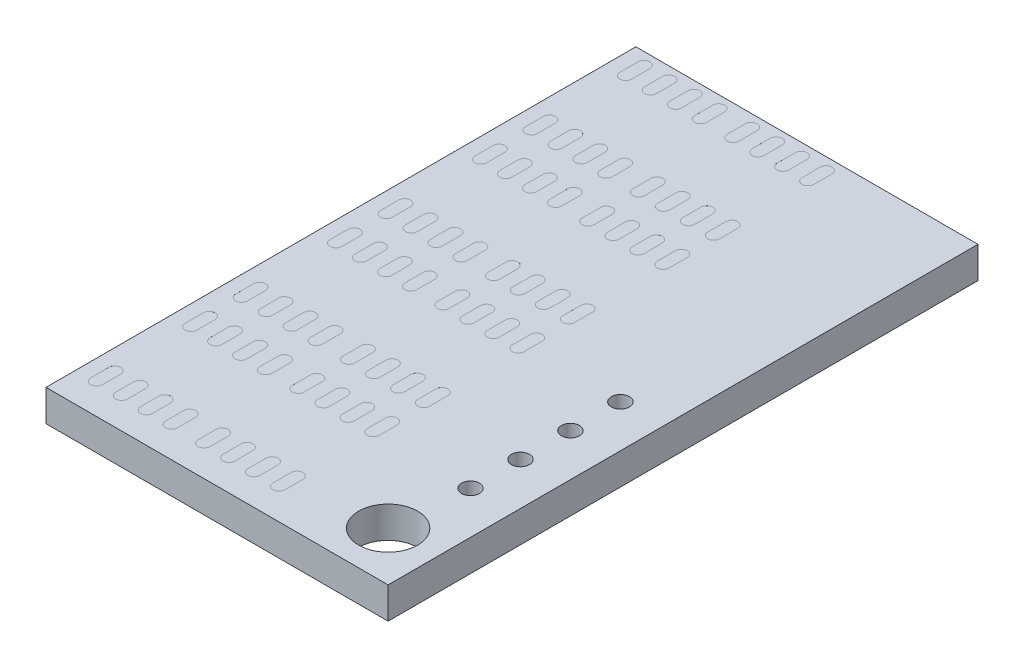
from build123d import *

# Parameters (mm, degrees)
SKETCH_1_W          = 17.4
SKETCH_1_H          = 30
EXTRUDE_1_DEPTH     = 1.6
SKETCH_2_R          = 1.5
SKETCH_2_R_2        = 0.457
CUT_EXTRUDE_1_DEPTH = 1.6
CUT_EXTRUDE_2_DEPTH = 0.0001


with BuildPart() as part:
    # Эскиз1 → Бобышка-Вытянуть1 (new body)
    with BuildSketch(Plane(origin=(0, 0, 0), x_dir=(1, 0, 0), z_dir=(0, 1, 0))):
        Rectangle(SKETCH_1_W, SKETCH_1_H)
    extrude(amount=EXTRUDE_1_DEPTH)

    # Эскиз2 → Вырез-Вытянуть1 (cut)
    with BuildSketch(Plane(origin=(0, 1.6, 0), x_dir=(1, 0, 0), z_dir=(0, 1, 0))):
        with Locations((6.2, -12.5)):
            Circle(SKETCH_2_R)
        with Locations((6.541, -1.03)):
            Circle(SKETCH_2_R_2)
        with Locations((6.541, -3.57)):
            Circle(SKETCH_2_R_2)
        with Locations((6.541, -6.11)):
            Circle(SKETCH_2_R_2)
        with Locations((6.541, -8.65)):
            Circle(SKETCH_2_R_2)
    extrude(amount=-CUT_EXTRUDE_1_DEPTH, mode=Mode.SUBTRACT)

    # Эскиз3 → Вырез-Вытянуть2 (cut)
    with BuildSketch(Plane(origin=(0, 1.6, 0), x_dir=(1, 0, 0), z_dir=(0, 1, 0))):
        with BuildLine():
            Line((-7.384, 14.39), (-7.384, 13.47))
            ThreePointArc((-7.384, 13.47), (-7.684, 13.17), (-7.984, 13.47))
            Line((-7.984, 13.47), (-7.984, 14.39))
            ThreePointArc((-7.984, 14.39), (-7.684, 14.69), (-7.384, 14.39))
        make_face()
        with BuildLine():
            Line((-6.114, 14.39), (-6.114, 13.47))
            ThreePointArc((-6.114, 13.47), (-6.414, 13.17), (-6.714, 13.47))
            Line((-6.714, 13.47), (-6.714, 14.39))
            ThreePointArc((-6.714, 14.39), (-6.414, 14.69), (-6.114, 14.39))
        make_face()
        with BuildLine():
            Line((-4.844, 14.39), (-4.844, 13.47))
            ThreePointArc((-4.844, 13.47), (-5.144, 13.17), (-5.444, 13.47))
            Line((-5.444, 13.47), (-5.444, 14.39))
            ThreePointArc((-5.444, 14.39), (-5.144, 14.69), (-4.844, 14.39))
        make_face()
        with BuildLine():
            Line((-3.574, 14.39), (-3.574, 13.47))
            ThreePointArc((-3.574, 13.47), (-3.874, 13.17), (-4.174, 13.47))
            Line((-4.174, 13.47), (-4.174, 14.39))
            ThreePointArc((-4.174, 14.39), (-3.874, 14.69), (-3.574, 14.39))
        make_face()
        with BuildLine():
            Line((-6.114, 9.59), (-6.114, 8.67))
            ThreePointArc((-6.114, 8.67), (-6.414, 8.37), (-6.714, 8.67))
            Line((-6.714, 8.67), (-6.714, 9.59))
            ThreePointArc((-6.714, 9.59), (-6.414, 9.89), (-6.114, 9.59))
        make_face()
        with BuildLine():
            Line((-4.844, 9.59), (-4.844, 8.67))
            ThreePointArc((-4.844, 8.67), (-5.144, 8.37), (-5.444, 8.67))
            Line((-5.444, 8.67), (-5.444, 9.59))
            ThreePointArc((-5.444, 9.59), (-5.144, 9.89), (-4.844, 9.59))
        make_face()
        with BuildLine():
            Line((-3.574, 9.59), (-3.574, 8.67))
            ThreePointArc((-3.574, 8.67), (-3.874, 8.37), (-4.174, 8.67))
            Line((-4.174, 8.67), (-4.174, 9.59))
            ThreePointArc((-4.174, 9.59), (-3.874, 9.89), (-3.574, 9.59))
        make_face()
        with BuildLine():
            Line((-7.384, 9.59), (-7.384, 8.67))
            ThreePointArc((-7.384, 8.67), (-7.684, 8.37), (-7.984, 8.67))
            Line((-7.984, 8.67), (-7.984, 9.59))
            ThreePointArc((-7.984, 9.59), (-7.684, 9.89), (-7.384, 9.59))
        make_face()
        with BuildLine():
            Line((-1.924, 14.39), (-1.924, 13.47))
            ThreePointArc((-1.924, 13.47), (-2.224, 13.17), (-2.524, 13.47))
            Line((-2.524, 13.47), (-2.524, 14.39))
            ThreePointArc((-2.524, 14.39), (-2.224, 14.69), (-1.924, 14.39))
        make_face()
        with BuildLine():
            Line((-0.654, 14.39), (-0.654, 13.47))
            ThreePointArc((-0.654, 13.47), (-0.954, 13.17), (-1.254, 13.47))
            Line((-1.254, 13.47), (-1.254, 14.39))
            ThreePointArc((-1.254, 14.39), (-0.954, 14.69), (-0.654, 14.39))
        make_face()
        with BuildLine():
            Line((0.616, 14.39), (0.616, 13.47))
            ThreePointArc((0.616, 13.47), (0.316, 13.17), (0.016, 13.47))
            Line((0.016, 13.47), (0.016, 14.39))
            ThreePointArc((0.016, 14.39), (0.316, 14.69), (0.616, 14.39))
        make_face()
        with BuildLine():
            Line((1.886, 14.39), (1.886, 13.47))
            ThreePointArc((1.886, 13.47), (1.586, 13.17), (1.286, 13.47))
            Line((1.286, 13.47), (1.286, 14.39))
            ThreePointArc((1.286, 14.39), (1.586, 14.69), (1.886, 14.39))
        make_face()
        with BuildLine():
            Line((-0.654, 9.59), (-0.654, 8.67))
            ThreePointArc((-0.654, 8.67), (-0.954, 8.37), (-1.254, 8.67))
            Line((-1.254, 8.67), (-1.254, 9.59))
            ThreePointArc((-1.254, 9.59), (-0.954, 9.89), (-0.654, 9.59))
        make_face()
        with BuildLine():
            Line((0.616, 9.59), (0.616, 8.67))
            ThreePointArc((0.616, 8.67), (0.316, 8.37), (0.016, 8.67))
            Line((0.016, 8.67), (0.016, 9.59))
            ThreePointArc((0.016, 9.59), (0.316, 9.89), (0.616, 9.59))
        make_face()
        with BuildLine():
            Line((1.886, 9.59), (1.886, 8.67))
            ThreePointArc((1.886, 8.67), (1.586, 8.37), (1.286, 8.67))
            Line((1.286, 8.67), (1.286, 9.59))
            ThreePointArc((1.286, 9.59), (1.586, 9.89), (1.886, 9.59))
        make_face()
        with BuildLine():
            Line((-1.924, 9.59), (-1.924, 8.67))
            ThreePointArc((-1.924, 8.67), (-2.224, 8.37), (-2.524, 8.67))
            Line((-2.524, 8.67), (-2.524, 9.59))
            ThreePointArc((-2.524, 9.59), (-2.224, 9.89), (-1.924, 9.59))
        make_face()
        with BuildLine():
            Line((-1.924, 7.02), (-1.924, 6.1))
            ThreePointArc((-1.924, 6.1), (-2.224, 5.8), (-2.524, 6.1))
            Line((-2.524, 6.1), (-2.524, 7.02))
            ThreePointArc((-2.524, 7.02), (-2.224, 7.32), (-1.924, 7.02))
        make_face()
        with BuildLine():
            Line((-0.654, 7.02), (-0.654, 6.1))
            ThreePointArc((-0.654, 6.1), (-0.954, 5.8), (-1.254, 6.1))
            Line((-1.254, 6.1), (-1.254, 7.02))
            ThreePointArc((-1.254, 7.02), (-0.954, 7.32), (-0.654, 7.02))
        make_face()
        with BuildLine():
            Line((0.616, 7.02), (0.616, 6.1))
            ThreePointArc((0.616, 6.1), (0.316, 5.8), (0.016, 6.1))
            Line((0.016, 6.1), (0.016, 7.02))
            ThreePointArc((0.016, 7.02), (0.316, 7.32), (0.616, 7.02))
        make_face()
        with BuildLine():
            Line((1.886, 7.02), (1.886, 6.1))
            ThreePointArc((1.886, 6.1), (1.586, 5.8), (1.286, 6.1))
            Line((1.286, 6.1), (1.286, 7.02))
            ThreePointArc((1.286, 7.02), (1.586, 7.32), (1.886, 7.02))
        make_face()
        with BuildLine():
            Line((-0.654, 2.22), (-0.654, 1.3))
            ThreePointArc((-0.654, 1.3), (-0.954, 1), (-1.254, 1.3))
            Line((-1.254, 1.3), (-1.254, 2.22))
            ThreePointArc((-1.254, 2.22), (-0.954, 2.52), (-0.654, 2.22))
        make_face()
        with BuildLine():
            Line((0.616, 2.22), (0.616, 1.3))
            ThreePointArc((0.616, 1.3), (0.316, 1), (0.016, 1.3))
            Line((0.016, 1.3), (0.016, 2.22))
            ThreePointArc((0.016, 2.22), (0.316, 2.52), (0.616, 2.22))
        make_face()
        with BuildLine():
            Line((1.886, 2.22), (1.886, 1.3))
            ThreePointArc((1.886, 1.3), (1.586, 1), (1.286, 1.3))
            Line((1.286, 1.3), (1.286, 2.22))
            ThreePointArc((1.286, 2.22), (1.586, 2.52), (1.886, 2.22))
        make_face()
        with BuildLine():
            Line((-1.924, 2.22), (-1.924, 1.3))
            ThreePointArc((-1.924, 1.3), (-2.224, 1), (-2.524, 1.3))
            Line((-2.524, 1.3), (-2.524, 2.22))
            ThreePointArc((-2.524, 2.22), (-2.224, 2.52), (-1.924, 2.22))
        make_face()
        with BuildLine():
            Line((-1.924, -0.35), (-1.924, -1.27))
            ThreePointArc((-1.924, -1.27), (-2.224, -1.57), (-2.524, -1.27))
            Line((-2.524, -1.27), (-2.524, -0.35))
            ThreePointArc((-2.524, -0.35), (-2.224, -0.05), (-1.924, -0.35))
        make_face()
        with BuildLine():
            Line((-0.654, -0.35), (-0.654, -1.27))
            ThreePointArc((-0.654, -1.27), (-0.954, -1.57), (-1.254, -1.27))
            Line((-1.254, -1.27), (-1.254, -0.35))
            ThreePointArc((-1.254, -0.35), (-0.954, -0.05), (-0.654, -0.35))
        make_face()
        with BuildLine():
            Line((0.616, -0.35), (0.616, -1.27))
            ThreePointArc((0.616, -1.27), (0.316, -1.57), (0.016, -1.27))
            Line((0.016, -1.27), (0.016, -0.35))
            ThreePointArc((0.016, -0.35), (0.316, -0.05), (0.616, -0.35))
        make_face()
        with BuildLine():
            Line((1.886, -0.35), (1.886, -1.27))
            ThreePointArc((1.886, -1.27), (1.586, -1.57), (1.286, -1.27))
            Line((1.286, -1.27), (1.286, -0.35))
            ThreePointArc((1.286, -0.35), (1.586, -0.05), (1.886, -0.35))
        make_face()
        with BuildLine():
            Line((-0.654, -5.15), (-0.654, -6.07))
            ThreePointArc((-0.654, -6.07), (-0.954, -6.37), (-1.254, -6.07))
            Line((-1.254, -6.07), (-1.254, -5.15))
            ThreePointArc((-1.254, -5.15), (-0.954, -4.85), (-0.654, -5.15))
        make_face()
        with BuildLine():
            Line((0.616, -5.15), (0.616, -6.07))
            ThreePointArc((0.616, -6.07), (0.316, -6.37), (0.016, -6.07))
            Line((0.016, -6.07), (0.016, -5.15))
            ThreePointArc((0.016, -5.15), (0.316, -4.85), (0.616, -5.15))
        make_face()
        with BuildLine():
            Line((1.886, -5.15), (1.886, -6.07))
            ThreePointArc((1.886, -6.07), (1.586, -6.37), (1.286, -6.07))
            Line((1.286, -6.07), (1.286, -5.15))
            ThreePointArc((1.286, -5.15), (1.586, -4.85), (1.886, -5.15))
        make_face()
        with BuildLine():
            Line((-1.924, -5.15), (-1.924, -6.07))
            ThreePointArc((-1.924, -6.07), (-2.224, -6.37), (-2.524, -6.07))
            Line((-2.524, -6.07), (-2.524, -5.15))
            ThreePointArc((-2.524, -5.15), (-2.224, -4.85), (-1.924, -5.15))
        make_face()
        with BuildLine():
            Line((-1.924, -7.72), (-1.924, -8.64))
            ThreePointArc((-1.924, -8.64), (-2.224, -8.94), (-2.524, -8.64))
            Line((-2.524, -8.64), (-2.524, -7.72))
            ThreePointArc((-2.524, -7.72), (-2.224, -7.42), (-1.924, -7.72))
        make_face()
        with BuildLine():
            Line((-0.654, -7.72), (-0.654, -8.64))
            ThreePointArc((-0.654, -8.64), (-0.954, -8.94), (-1.254, -8.64))
            Line((-1.254, -8.64), (-1.254, -7.72))
            ThreePointArc((-1.254, -7.72), (-0.954, -7.42), (-0.654, -7.72))
        make_face()
        with BuildLine():
            Line((0.616, -7.72), (0.616, -8.64))
            ThreePointArc((0.616, -8.64), (0.316, -8.94), (0.016, -8.64))
            Line((0.016, -8.64), (0.016, -7.72))
            ThreePointArc((0.016, -7.72), (0.316, -7.42), (0.616, -7.72))
        make_face()
        with BuildLine():
            Line((1.886, -7.72), (1.886, -8.64))
            ThreePointArc((1.886, -8.64), (1.586, -8.94), (1.286, -8.64))
            Line((1.286, -8.64), (1.286, -7.72))
            ThreePointArc((1.286, -7.72), (1.586, -7.42), (1.886, -7.72))
        make_face()
        with BuildLine():
            Line((-0.654, -12.52), (-0.654, -13.44))
            ThreePointArc((-0.654, -13.44), (-0.954, -13.74), (-1.254, -13.44))
            Line((-1.254, -13.44), (-1.254, -12.52))
            ThreePointArc((-1.254, -12.52), (-0.954, -12.22), (-0.654, -12.52))
        make_face()
        with BuildLine():
            Line((0.616, -12.52), (0.616, -13.44))
            ThreePointArc((0.616, -13.44), (0.316, -13.74), (0.016, -13.44))
            Line((0.016, -13.44), (0.016, -12.52))
            ThreePointArc((0.016, -12.52), (0.316, -12.22), (0.616, -12.52))
        make_face()
        with BuildLine():
            Line((1.886, -12.52), (1.886, -13.44))
            ThreePointArc((1.886, -13.44), (1.586, -13.74), (1.286, -13.44))
            Line((1.286, -13.44), (1.286, -12.52))
            ThreePointArc((1.286, -12.52), (1.586, -12.22), (1.886, -12.52))
        make_face()
        with BuildLine():
            Line((-1.924, -12.52), (-1.924, -13.44))
            ThreePointArc((-1.924, -13.44), (-2.224, -13.74), (-2.524, -13.44))
            Line((-2.524, -13.44), (-2.524, -12.52))
            ThreePointArc((-2.524, -12.52), (-2.224, -12.22), (-1.924, -12.52))
        make_face()
        with BuildLine():
            Line((-7.384, 7.02), (-7.384, 6.1))
            ThreePointArc((-7.384, 6.1), (-7.684, 5.8), (-7.984, 6.1))
            Line((-7.984, 6.1), (-7.984, 7.02))
            ThreePointArc((-7.984, 7.02), (-7.684, 7.32), (-7.384, 7.02))
        make_face()
        with BuildLine():
            Line((-6.114, 7.02), (-6.114, 6.1))
            ThreePointArc((-6.114, 6.1), (-6.414, 5.8), (-6.714, 6.1))
            Line((-6.714, 6.1), (-6.714, 7.02))
            ThreePointArc((-6.714, 7.02), (-6.414, 7.32), (-6.114, 7.02))
        make_face()
        with BuildLine():
            Line((-4.844, 7.02), (-4.844, 6.1))
            ThreePointArc((-4.844, 6.1), (-5.144, 5.8), (-5.444, 6.1))
            Line((-5.444, 6.1), (-5.444, 7.02))
            ThreePointArc((-5.444, 7.02), (-5.144, 7.32), (-4.844, 7.02))
        make_face()
        with BuildLine():
            Line((-3.574, 7.02), (-3.574, 6.1))
            ThreePointArc((-3.574, 6.1), (-3.874, 5.8), (-4.174, 6.1))
            Line((-4.174, 6.1), (-4.174, 7.02))
            ThreePointArc((-4.174, 7.02), (-3.874, 7.32), (-3.574, 7.02))
        make_face()
        with BuildLine():
            Line((-6.114, 2.22), (-6.114, 1.3))
            ThreePointArc((-6.114, 1.3), (-6.414, 1), (-6.714, 1.3))
            Line((-6.714, 1.3), (-6.714, 2.22))
            ThreePointArc((-6.714, 2.22), (-6.414, 2.52), (-6.114, 2.22))
        make_face()
        with BuildLine():
            Line((-4.844, 2.22), (-4.844, 1.3))
            ThreePointArc((-4.844, 1.3), (-5.144, 1), (-5.444, 1.3))
            Line((-5.444, 1.3), (-5.444, 2.22))
            ThreePointArc((-5.444, 2.22), (-5.144, 2.52), (-4.844, 2.22))
        make_face()
        with BuildLine():
            Line((-3.574, 2.22), (-3.574, 1.3))
            ThreePointArc((-3.574, 1.3), (-3.874, 1), (-4.174, 1.3))
            Line((-4.174, 1.3), (-4.174, 2.22))
            ThreePointArc((-4.174, 2.22), (-3.874, 2.52), (-3.574, 2.22))
        make_face()
        with BuildLine():
            Line((-7.384, 2.22), (-7.384, 1.3))
            ThreePointArc((-7.384, 1.3), (-7.684, 1), (-7.984, 1.3))
            Line((-7.984, 1.3), (-7.984, 2.22))
            ThreePointArc((-7.984, 2.22), (-7.684, 2.52), (-7.384, 2.22))
        make_face()
        with BuildLine():
            Line((-7.384, -0.35), (-7.384, -1.27))
            ThreePointArc((-7.384, -1.27), (-7.684, -1.57), (-7.984, -1.27))
            Line((-7.984, -1.27), (-7.984, -0.35))
            ThreePointArc((-7.984, -0.35), (-7.684, -0.05), (-7.384, -0.35))
        make_face()
        with BuildLine():
            Line((-6.114, -0.35), (-6.114, -1.27))
            ThreePointArc((-6.114, -1.27), (-6.414, -1.57), (-6.714, -1.27))
            Line((-6.714, -1.27), (-6.714, -0.35))
            ThreePointArc((-6.714, -0.35), (-6.414, -0.05), (-6.114, -0.35))
        make_face()
        with BuildLine():
            Line((-4.844, -0.35), (-4.844, -1.27))
            ThreePointArc((-4.844, -1.27), (-5.144, -1.57), (-5.444, -1.27))
            Line((-5.444, -1.27), (-5.444, -0.35))
            ThreePointArc((-5.444, -0.35), (-5.144, -0.05), (-4.844, -0.35))
        make_face()
        with BuildLine():
            Line((-3.574, -0.35), (-3.574, -1.27))
            ThreePointArc((-3.574, -1.27), (-3.874, -1.57), (-4.174, -1.27))
            Line((-4.174, -1.27), (-4.174, -0.35))
            ThreePointArc((-4.174, -0.35), (-3.874, -0.05), (-3.574, -0.35))
        make_face()
        with BuildLine():
            Line((-6.114, -5.15), (-6.114, -6.07))
            ThreePointArc((-6.114, -6.07), (-6.414, -6.37), (-6.714, -6.07))
            Line((-6.714, -6.07), (-6.714, -5.15))
            ThreePointArc((-6.714, -5.15), (-6.414, -4.85), (-6.114, -5.15))
        make_face()
        with BuildLine():
            Line((-4.844, -5.15), (-4.844, -6.07))
            ThreePointArc((-4.844, -6.07), (-5.144, -6.37), (-5.444, -6.07))
            Line((-5.444, -6.07), (-5.444, -5.15))
            ThreePointArc((-5.444, -5.15), (-5.144, -4.85), (-4.844, -5.15))
        make_face()
        with BuildLine():
            Line((-3.574, -5.15), (-3.574, -6.07))
            ThreePointArc((-3.574, -6.07), (-3.874, -6.37), (-4.174, -6.07))
            Line((-4.174, -6.07), (-4.174, -5.15))
            ThreePointArc((-4.174, -5.15), (-3.874, -4.85), (-3.574, -5.15))
        make_face()
        with BuildLine():
            Line((-7.384, -5.15), (-7.384, -6.07))
            ThreePointArc((-7.384, -6.07), (-7.684, -6.37), (-7.984, -6.07))
            Line((-7.984, -6.07), (-7.984, -5.15))
            ThreePointArc((-7.984, -5.15), (-7.684, -4.85), (-7.384, -5.15))
        make_face()
        with BuildLine():
            Line((-7.384, -7.72), (-7.384, -8.64))
            ThreePointArc((-7.384, -8.64), (-7.684, -8.94), (-7.984, -8.64))
            Line((-7.984, -8.64), (-7.984, -7.72))
            ThreePointArc((-7.984, -7.72), (-7.684, -7.42), (-7.384, -7.72))
        make_face()
        with BuildLine():
            Line((-6.114, -7.72), (-6.114, -8.64))
            ThreePointArc((-6.114, -8.64), (-6.414, -8.94), (-6.714, -8.64))
            Line((-6.714, -8.64), (-6.714, -7.72))
            ThreePointArc((-6.714, -7.72), (-6.414, -7.42), (-6.114, -7.72))
        make_face()
        with BuildLine():
            Line((-4.844, -7.72), (-4.844, -8.64))
            ThreePointArc((-4.844, -8.64), (-5.144, -8.94), (-5.444, -8.64))
            Line((-5.444, -8.64), (-5.444, -7.72))
            ThreePointArc((-5.444, -7.72), (-5.144, -7.42), (-4.844, -7.72))
        make_face()
        with BuildLine():
            Line((-3.574, -7.72), (-3.574, -8.64))
            ThreePointArc((-3.574, -8.64), (-3.874, -8.94), (-4.174, -8.64))
            Line((-4.174, -8.64), (-4.174, -7.72))
            ThreePointArc((-4.174, -7.72), (-3.874, -7.42), (-3.574, -7.72))
        make_face()
        with BuildLine():
            Line((-6.114, -12.52), (-6.114, -13.44))
            ThreePointArc((-6.114, -13.44), (-6.414, -13.74), (-6.714, -13.44))
            Line((-6.714, -13.44), (-6.714, -12.52))
            ThreePointArc((-6.714, -12.52), (-6.414, -12.22), (-6.114, -12.52))
        make_face()
        with BuildLine():
            Line((-4.844, -12.52), (-4.844, -13.44))
            ThreePointArc((-4.844, -13.44), (-5.144, -13.74), (-5.444, -13.44))
            Line((-5.444, -13.44), (-5.444, -12.52))
            ThreePointArc((-5.444, -12.52), (-5.144, -12.22), (-4.844, -12.52))
        make_face()
        with BuildLine():
            Line((-3.574, -12.52), (-3.574, -13.44))
            ThreePointArc((-3.574, -13.44), (-3.874, -13.74), (-4.174, -13.44))
            Line((-4.174, -13.44), (-4.174, -12.52))
            ThreePointArc((-4.174, -12.52), (-3.874, -12.22), (-3.574, -12.52))
        make_face()
        with BuildLine():
            Line((-7.384, -12.52), (-7.384, -13.44))
            ThreePointArc((-7.384, -13.44), (-7.684, -13.74), (-7.984, -13.44))
            Line((-7.984, -13.44), (-7.984, -12.52))
            ThreePointArc((-7.984, -12.52), (-7.684, -12.22), (-7.384, -12.52))
        make_face()
    extrude(amount=-CUT_EXTRUDE_2_DEPTH, mode=Mode.SUBTRACT)


solid = part.part
